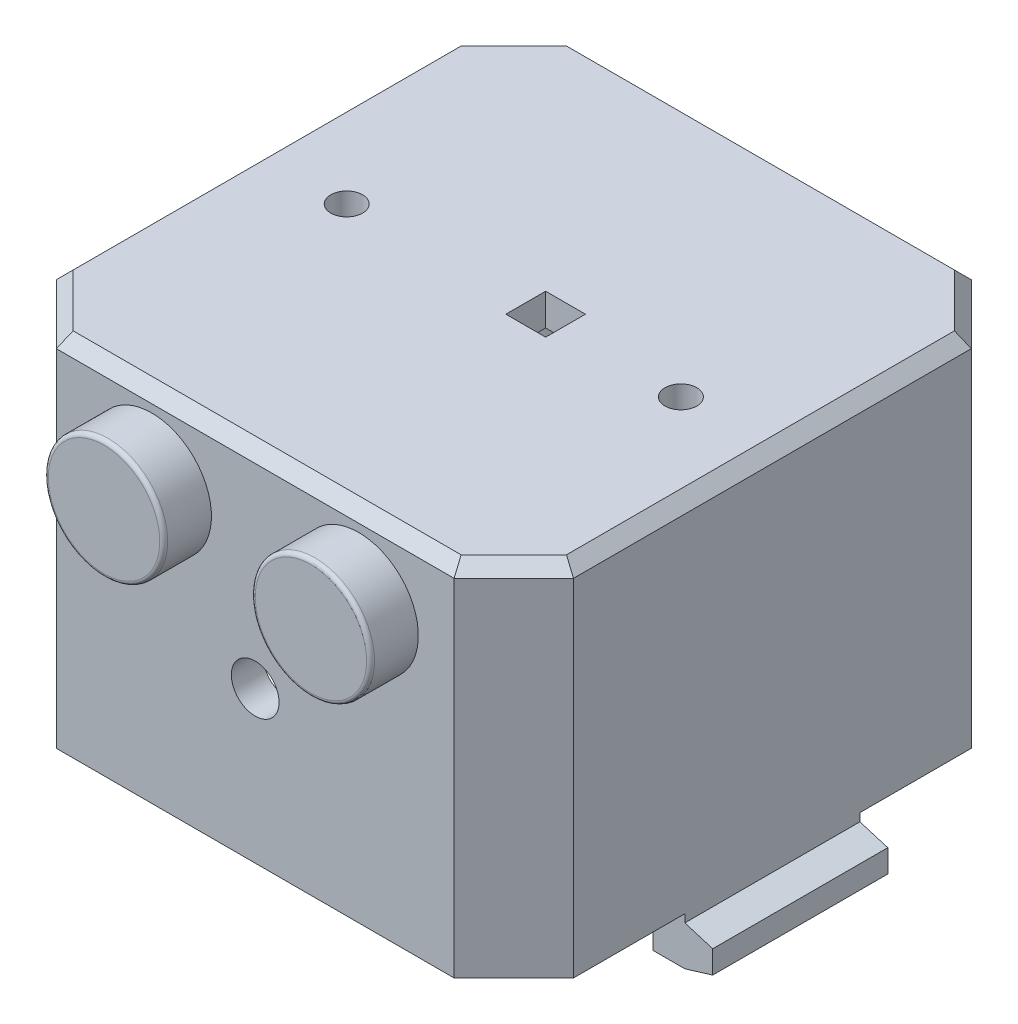
from build123d import *

# Parameters (mm, degrees)
SALIENTE_EXTRUIR1_DEPTH  = 45
VACIADO2_T               = -4
CHAFL_N3_SIZE            = 1.5
CROQUIS2_R               = 7.5
SALIENTE_EXTRUIR2_DEPTH  = 6
CROQUIS4_R               = 5
CORTAR_EXTRUIR2_DEPTH    = 8
REDONDEO1_R              = 0.5
CROQUIS5_R               = 3
CORTAR_EXTRUIR3_DEPTH    = 10
SALIENTE_EXTRUIR8_START  = 8
CROQUIS13_R              = 5
CROQUIS13_R_2            = 2.6
SALIENTE_EXTRUIR8_DEPTH  = 8
CROQUIS7_W               = 5
CROQUIS7_H               = 5
SALIENTE_EXTRUIR3_DEPTH  = 1
CROQUIS8_R               = 2.5
SALIENTE_EXTRUIR4_DEPTH  = 1
CROQUIS9_R               = 1.6
CORTAR_EXTRUIR5_DEPTH    = 4
CROQUIS12_R              = 1.15
CROQUIS12_R_2            = 0.8
SALIENTE_EXTRUIR7_DEPTH  = 6
CROQUIS14_W              = 3
CROQUIS14_H              = 2.5
SALIENTE_EXTRUIR9_DEPTH  = 5
CROQUIS15_W              = 12
CROQUIS15_H              = 8
CORTAR_EXTRUIR6_DEPTH    = 7
CROQUIS16_W              = 14.5
CROQUIS16_H              = 14.5
CROQUIS16_W_2            = 12.4
CROQUIS16_H_2            = 12.4
SALIENTE_EXTRUIR10_DEPTH = 3
CROQUIS17_R              = 5.5
CORTAR_EXTRUIR7_DEPTH    = 88.007183611
CROQUIS18_W              = 4
CROQUIS18_H              = 22
SALIENTE_EXTRUIR11_DEPTH = 6
SALIENTE_EXTRUIR13_DEPTH = 22
CROQUIS20_W              = 5
CROQUIS20_H              = 5
CORTAR_EXTRUIR8_DEPTH    = 10
CROQUIS10_R              = 2
CORTAR_EXTRUIR10_DEPTH   = 74.343370525
CORTAR_EXTRUIR11_START   = -5
CROQUIS21_R              = 0.8
CORTAR_EXTRUIR11_DEPTH   = 5


with BuildPart() as part:
    # Croquis1 → Saliente-Extruir1 (new body)
    with BuildSketch(Plane(origin=(0, 0, 0), x_dir=(1, 0, 0), z_dir=(0, 1, 0))):
        Polygon((-25, -32.5), (25, -32.5), (32.5, -25), (32.5, 25), (25, 32.5), (-25, 32.5), (-32.5, 25), (-32.5, -25), align=None)
    extrude(amount=SALIENTE_EXTRUIR1_DEPTH)

    # Vaciado2
    vaciado2_openings = [part.faces().sort_by_distance(p)[0] for p in [
        (0, 0, 0),
    ]]
    offset(amount=VACIADO2_T, openings=vaciado2_openings, kind=Kind.INTERSECTION)

    # Chaflán3
    chafl_n3_edges = [part.edges().sort_by_distance(p)[0] for p in [
        (0, 45, -32.5),
        (32.5, 45, 0),
        (0, 45, 32.5),
        (-32.5, 45, 0),
        (-28.75, 45, 28.75),
        (28.75, 45, 28.75),
        (28.75, 45, -28.75),
        (-28.75, 45, -28.75),
    ]]
    chamfer(chafl_n3_edges, length=CHAFL_N3_SIZE)

    # Croquis2 → Saliente-Extruir2 (add)
    with BuildSketch(Plane.XY.offset(32.5)):
        with Locations((13, 35)):
            Circle(CROQUIS2_R)
        with Locations((-13, 35)):
            Circle(CROQUIS2_R)
    extrude(amount=SALIENTE_EXTRUIR2_DEPTH)

    # Croquis4 → Cortar-Extruir2 (cut)
    with BuildSketch(Plane(origin=(0, 0, 28.5), x_dir=(-1, 0, 0), z_dir=(0, 0, -1))):
        with Locations((-13, 35)):
            Circle(CROQUIS4_R)
        with Locations((13, 35)):
            Circle(CROQUIS4_R)
    extrude(amount=-CORTAR_EXTRUIR2_DEPTH, mode=Mode.SUBTRACT)

    # Redondeo1
    redondeo1_edges = [part.edges().sort_by_distance(p)[0] for p in [
        (-20.5, 35, 38.5),
        (5.5, 35, 38.5),
    ]]
    fillet(redondeo1_edges, radius=REDONDEO1_R)

    # Croquis5 → Cortar-Extruir3 (cut)
    with BuildSketch(Plane.XY.offset(32.5)):
        with Locations((0, 19)):
            Circle(CROQUIS5_R)
    extrude(amount=-CORTAR_EXTRUIR3_DEPTH, mode=Mode.SUBTRACT)

    # Croquis13 → Saliente-Extruir8 (add)
    # profile 1 of 2: a face of its own
    with BuildSketch(Plane(origin=(0, 0, 36.5), x_dir=(-1, 0, 0), z_dir=(0, 0, -1)).offset(SALIENTE_EXTRUIR8_START)):
        with Locations((13, 35)):
            Circle(CROQUIS13_R)
        with Locations((13, 35)):
            Circle(CROQUIS13_R_2, mode=Mode.SUBTRACT)
    # profile 2 of 2: a face of its own
    with BuildSketch(Plane(origin=(0, 0, 36.5), x_dir=(-1, 0, 0), z_dir=(0, 0, -1)).offset(SALIENTE_EXTRUIR8_START)):
        with Locations((-13, 35)):
            Circle(CROQUIS13_R)
        with Locations((-13, 35)):
            Circle(CROQUIS13_R_2, mode=Mode.SUBTRACT)
    extrude(amount=-SALIENTE_EXTRUIR8_DEPTH)

    # Croquis7 → Saliente-Extruir3 (add)
    with BuildSketch(Plane(origin=(0, 0, 28.5), x_dir=(-1, 0, 0), z_dir=(0, 0, -1))):
        with Locations((-11.58, 10.5)):
            Rectangle(CROQUIS7_W, CROQUIS7_H)
        with Locations((-11.58, 28)):
            Rectangle(CROQUIS7_W, CROQUIS7_H)
        with Locations((11.43, 10.5)):
            Rectangle(CROQUIS7_W, CROQUIS7_H)
        with Locations((11.43, 28)):
            Rectangle(CROQUIS7_W, CROQUIS7_H)
    extrude(amount=SALIENTE_EXTRUIR3_DEPTH)

    # Croquis8 → Saliente-Extruir4 (add)
    with BuildSketch(Plane(origin=(0, 0, 27.5), x_dir=(-1, 0, 0), z_dir=(0, 0, -1))):
        with Locations((-11.505, 10.489346828)):
            Circle(CROQUIS8_R)
        with Locations((-11.505, 27.976317365)):
            Circle(CROQUIS8_R)
        with Locations((11.505, 10.489346828)):
            Circle(CROQUIS8_R)
        with Locations((11.505, 27.976317365)):
            Circle(CROQUIS8_R)
    extrude(amount=SALIENTE_EXTRUIR4_DEPTH)

    # Croquis9 → Cortar-Extruir5 (cut)
    with BuildSketch(Plane(origin=(0, 0, 26.5), x_dir=(-1, 0, 0), z_dir=(0, 0, -1))):
        with Locations((-11.505, 27.976317365)):
            Circle(CROQUIS9_R)
        with Locations((-11.505, 10.489346828)):
            Circle(CROQUIS9_R)
        with Locations((11.505, 10.489346828)):
            Circle(CROQUIS9_R)
        with Locations((11.505, 27.976317365)):
            Circle(CROQUIS9_R)
    extrude(amount=-CORTAR_EXTRUIR5_DEPTH, mode=Mode.SUBTRACT)

    # Croquis12 → Saliente-Extruir7 (add)
    # profile 1 of 4: a face of its own
    with BuildSketch(Plane.XZ.offset(-41)):
        with Locations((-20.65, 7.68)):
            Circle(CROQUIS12_R)
        with Locations((-20.65, 7.68)):
            Circle(CROQUIS12_R_2, mode=Mode.SUBTRACT)
    # profile 2 of 4: a face of its own
    with BuildSketch(Plane.XZ.offset(-41)):
        with Locations((-20.65, -7.68)):
            Circle(CROQUIS12_R)
        with Locations((-20.65, -7.68)):
            Circle(CROQUIS12_R_2, mode=Mode.SUBTRACT)
    # profile 3 of 4: a face of its own
    with BuildSketch(Plane.XZ.offset(-41)):
        with Locations((20.65, 7.68)):
            Circle(CROQUIS12_R)
        with Locations((20.65, 7.68)):
            Circle(CROQUIS12_R_2, mode=Mode.SUBTRACT)
    # profile 4 of 4: a face of its own
    with BuildSketch(Plane.XZ.offset(-41)):
        with Locations((20.65, -7.68)):
            Circle(CROQUIS12_R)
        with Locations((20.65, -7.68)):
            Circle(CROQUIS12_R_2, mode=Mode.SUBTRACT)
    extrude(amount=SALIENTE_EXTRUIR7_DEPTH)

    # Croquis14 → Saliente-Extruir9 (add)
    with BuildSketch(Plane.XZ.offset(-41)):
        with Locations((-20.65, 7.68)):
            Rectangle(CROQUIS14_W, CROQUIS14_H)
        with Locations((-20.65, -7.68)):
            Rectangle(CROQUIS14_W, CROQUIS14_H)
        with Locations((20.65, 7.68)):
            Rectangle(CROQUIS14_W, CROQUIS14_H)
        with Locations((20.65, -7.68)):
            Rectangle(CROQUIS14_W, CROQUIS14_H)
    extrude(amount=SALIENTE_EXTRUIR9_DEPTH)

    # Croquis15 → Cortar-Extruir6 (cut)
    with BuildSketch(Plane.ZY.offset(32.5)):
        with Locations((0, 36.5)):
            Rectangle(CROQUIS15_W, CROQUIS15_H)
    extrude(amount=-CORTAR_EXTRUIR6_DEPTH, mode=Mode.SUBTRACT)

    # Croquis16 → Saliente-Extruir10 (add)
    with BuildSketch(Plane.XY.offset(-28.5)):
        with Locations((12.75, 12.25)):
            Rectangle(CROQUIS16_W, CROQUIS16_H)
        with Locations((12.75, 12.25)):
            Rectangle(CROQUIS16_W_2, CROQUIS16_H_2, mode=Mode.SUBTRACT)
    extrude(amount=SALIENTE_EXTRUIR10_DEPTH)

    # Croquis17 → Cortar-Extruir7 (cut, through all)
    with BuildSketch(Plane.XY.offset(-28.5)):
        with Locations((12.75, 12.25)):
            Circle(CROQUIS17_R)
    extrude(amount=-CORTAR_EXTRUIR7_DEPTH, mode=Mode.SUBTRACT)

    # Croquis18 → Saliente-Extruir11 (add)
    with BuildSketch(Plane.XZ):
        with Locations((-30.5, 0)):
            Rectangle(CROQUIS18_W, CROQUIS18_H)
        with Locations((30.5, 0)):
            Rectangle(CROQUIS18_W, CROQUIS18_H)
    extrude(amount=SALIENTE_EXTRUIR11_DEPTH)

    # Croquis19 → Saliente-Extruir13 (add)
    with BuildSketch(Plane.XY.offset(11)):
        Polygon((36, -4.933333333), (36, -2.066666667), (32.5, -1), (32.5, -6), align=None)
        Polygon((-32.5, -1), (-34.5, -2.056793221), (-34.5, -4.943206779), (-32.5, -6), align=None)
    extrude(amount=-SALIENTE_EXTRUIR13_DEPTH)

    # Croquis20 → Cortar-Extruir8 (cut)
    with BuildSketch(Plane(origin=(0, 45, 0), x_dir=(1, 0, 0), z_dir=(0, 1, 0))):
        with Locations((3.50287975, 0.5)):
            Rectangle(CROQUIS20_W, CROQUIS20_H)
    extrude(amount=-CORTAR_EXTRUIR8_DEPTH, mode=Mode.SUBTRACT)

    # Croquis10 → Cortar-Extruir10 (cut, through all)
    with BuildSketch(Plane(origin=(0, 45, 0), x_dir=(1, 0, 0), z_dir=(0, 1, 0))):
        with Locations((-21, 0)):
            Circle(CROQUIS10_R)
        with Locations((21, 0)):
            Circle(CROQUIS10_R)
    extrude(amount=-CORTAR_EXTRUIR10_DEPTH, mode=Mode.SUBTRACT)

    # Croquis21 → Cortar-Extruir11 (cut)
    with BuildSketch(Plane.XZ.offset(-36).offset(CORTAR_EXTRUIR11_START)):
        with Locations((-20.65, 7.68)):
            Circle(CROQUIS21_R)
        with Locations((20.65, 7.68)):
            Circle(CROQUIS21_R)
        with Locations((20.65, -7.68)):
            Circle(CROQUIS21_R)
        with Locations((-20.65, -7.68)):
            Circle(CROQUIS21_R)
    extrude(amount=CORTAR_EXTRUIR11_DEPTH, mode=Mode.SUBTRACT)


solid = part.part
